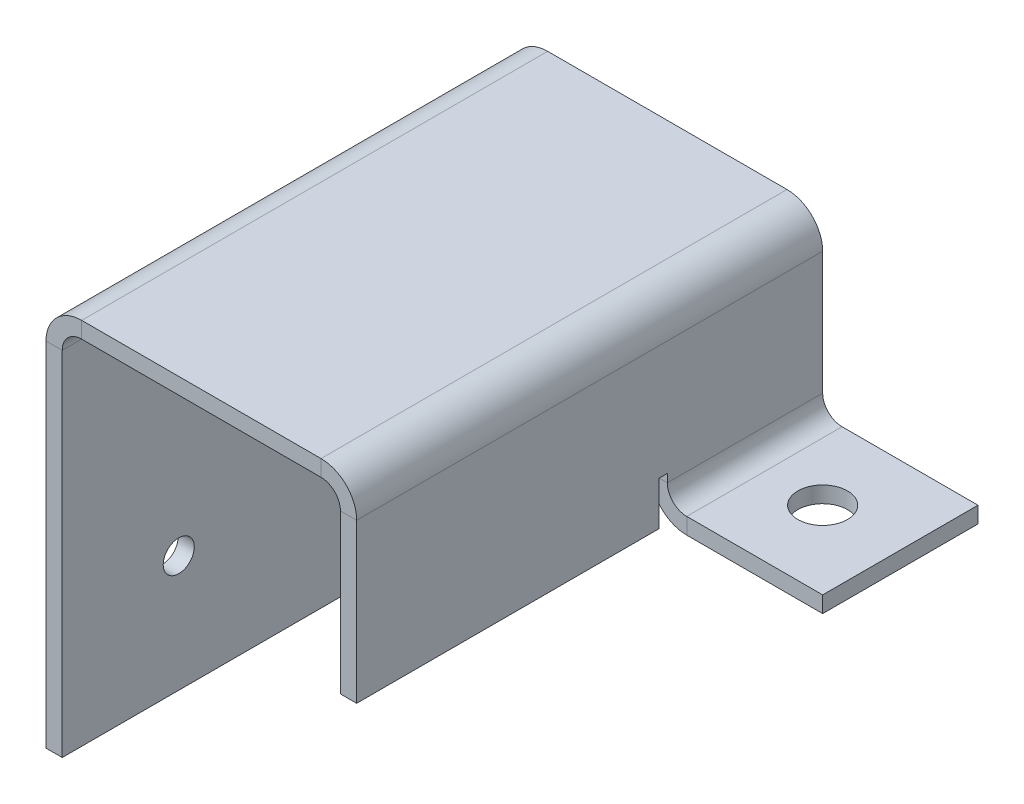
from build123d import *

# Parameters (mm, degrees)
BASE_FLANGE1_DEPTH    = 76.2
SKETCH5_R             = 2.54
CUT_EXTRUDE1_DEPTH    = 111.256309818
MITER_FLANGE1_DEPTH   = 26.72842
MITER_START           = 25.4
MITER_FLANGE1_2_DEPTH = 1.32842
MITER_FLANGE1_3_DEPTH = 25.4
SKETCH7_R             = 4.056943783
CUT_EXTRUDE2_DEPTH    = 114.122546996


# Read off the part's stored shape, not the designer's step: Miter Flange1
# Sheet-metal steps are written as plain solids
with BuildPart() as part:
    # Sketch3 → Base-Flange1 (new body)
    with BuildSketch(Plane.XY):
        with BuildLine():
            Line((50.8, 31.75), (50.8, 57.66816))
            ThreePointArc((50.8, 57.66816), (49.091893611, 61.791893611), (44.96816, 63.5))
            Line((44.96816, 63.5), (5.83184, 63.5))
            ThreePointArc((5.83184, 63.5), (1.708106389, 61.791893611), (0, 57.66816))
            Line((0, 57.66816), (0, 0))
            Line((0, 0), (2.65684, 0))
            Line((2.65684, 0), (2.65684, 57.66816))
            ThreePointArc((2.65684, 57.66816), (3.58677597, 59.91322403), (5.83184, 60.84316))
            Line((5.83184, 60.84316), (44.96816, 60.84316))
            ThreePointArc((44.96816, 60.84316), (47.21322403, 59.91322403), (48.14316, 57.66816))
            Line((48.14316, 57.66816), (48.14316, 31.75))
            Line((48.14316, 31.75), (50.8, 31.75))
        make_face()
    extrude(amount=BASE_FLANGE1_DEPTH)

    # Sketch5 → Cut-Extrude1 (cut, through all)
    with BuildSketch(Plane(origin=(2.65684, 0, 0), x_dir=(0, 0, -1), z_dir=(1, 0, 0))):
        with Locations(Location((-57.15, 19.05, 0), (0, 0, 90))):
            Circle(SKETCH5_R)
        with Locations(Location((-38.1, 44.45, 0), (0, 0, 90))):
            Circle(SKETCH5_R)
        with Locations(Location((-19.05, 19.05, 0), (0, 0, 90))):
            Circle(SKETCH5_R)
    extrude(amount=-CUT_EXTRUDE1_DEPTH, mode=Mode.SUBTRACT)

    # Miter Flange1 outline → Miter Flange1 (cut)
    with BuildSketch(Plane.XY):
        with BuildLine():
            Line((50.8, 31.75), (50.8, 32.690037389))
            ThreePointArc((50.8, 32.690037389), (48.850234162, 34.798472814), (48.14316, 37.58184))
            Line((48.14316, 37.58184), (48.14316, 31.75))
            Line((48.14316, 31.75), (50.8, 31.75))
        make_face()
    extrude(amount=MITER_FLANGE1_DEPTH, mode=Mode.SUBTRACT)

    # Miter Flange1 2 outline → Miter Flange1 2 (cut)
    with BuildSketch(Plane.XY.offset(MITER_START)):
        with BuildLine():
            ThreePointArc((48.14316, 37.58184), (48.850234162, 34.798472814), (50.8, 32.690037389))
            Line((50.8, 32.690037389), (50.8, 38.91026))
            Line((50.8, 38.91026), (48.14316, 38.91026))
            Line((48.14316, 38.91026), (48.14316, 37.58184))
        make_face()
    extrude(amount=MITER_FLANGE1_2_DEPTH, mode=Mode.SUBTRACT)

    # Miter Flange1 3 outline → Miter Flange1 3 (add)
    with BuildSketch(Plane.XY):
        with BuildLine():
            Line((53.975, 31.75), (76.2, 31.75))
            Line((76.2, 31.75), (76.2, 34.40684))
            Line((76.2, 34.40684), (53.975, 34.40684))
            ThreePointArc((53.975, 34.40684), (51.72993597, 35.33677597), (50.8, 37.58184))
            Line((50.8, 37.58184), (50.8, 32.690037389))
            ThreePointArc((50.8, 32.690037389), (52.319381136, 31.989945512), (53.975, 31.75))
        make_face()
    extrude(amount=MITER_FLANGE1_3_DEPTH)

    # Sketch7 → Cut-Extrude2 (cut, through all)
    with BuildSketch(Plane(origin=(0, 34.40684, 0), x_dir=(-1, 0, 0), z_dir=(0, 1, 0))):
        with Locations((-63.5, 12.7)):
            Circle(SKETCH7_R)
    extrude(amount=-CUT_EXTRUDE2_DEPTH, mode=Mode.SUBTRACT)


solid = part.part
